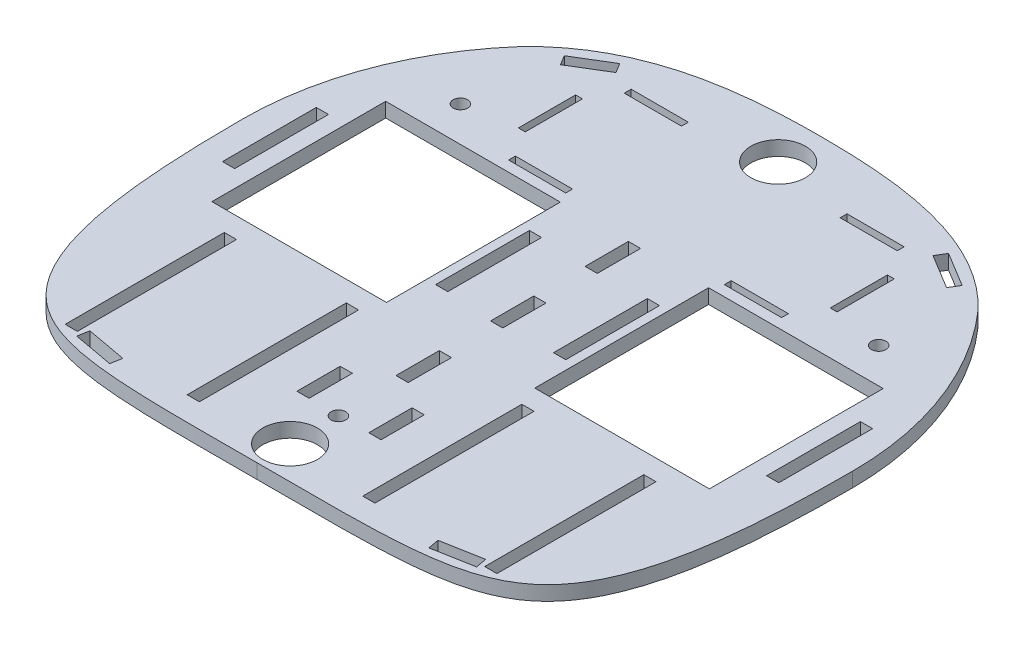
from build123d import *

# Parameters (mm, degrees)
BASE_DEPTH            = 6.35
SKETCH6_W             = 76.3515
SKETCH6_H             = 76
SKETCH6_W_2           = 5.334
SKETCH6_H_2           = 41.021
WHEELSHAFTCUT_DEPTH   = 189.692256213
SKETCH8_W             = 5.334
SKETCH8_H             = 69.573
SKETCH8_H_2           = 18.923
MOTORCUT_DEPTH        = 189.692256213
SKETCH10_W            = 25
SKETCH10_H            = 3
SKETCH10_W_2          = 3
SKETCH10_H_2          = 25
VELCROCUT_DEPTH       = 189.692256213
SKETCH11_R            = 3.175
SCREWCUT_DEPTH        = 189.692256213
SKETCH13_W            = 5.334
SKETCH13_H            = 18.923
SUPPORTSTRUTCUT_DEPTH = 189.692256213
EMPTYSPACETRIM_DEPTH  = 189.692256213
TAPESENSORCUT_DEPTH   = 185.275595127
SKETCH17_R            = 11.938
CASTERCUT_DEPTH       = 185.275595127


with BuildPart() as part:
    # Sketch1 → Base (new body)
    with BuildSketch(Plane(origin=(0, 0, 0), x_dir=(1, 0, 0), z_dir=(0, 1, 0))):
        with BuildLine():
            ThreePointArc((133.35, 0), (0, 133.35), (-133.35, 0))
            add(Edge.make_bspline(
                [(-133.35, 0), (-133.35, -51.197979728), (-123.803376308, -129.805052089), (-58.427993604, -127), (0, -127)],
                knots=[0, 0, 0, 0, 0.502616309, 1, 1, 1, 1], degree=3))
            add(Edge.make_bspline(
                [(133.35, 0), (133.35, -51.197979728), (123.803376308, -129.805052089), (58.427993604, -127), (0, -127)],
                knots=[0, 0, 0, 0, 0.502616309, 1, 1, 1, 1], degree=3))
        make_face()
    extrude(amount=BASE_DEPTH)

    # Sketch6 → WheelShaftCut (cut, through all)
    with BuildSketch(Plane(origin=(0, 6.35, 0), x_dir=(1, 0, 0), z_dir=(0, 1, 0))):
        with Locations((-70.592348141, 0)):
            Rectangle(SKETCH6_W, SKETCH6_H)
        with Locations((-118.959848141, 0)):
            Rectangle(SKETCH6_W_2, SKETCH6_H_2)
        with Locations((-25.780848141, 0)):
            Rectangle(SKETCH6_W_2, SKETCH6_H_2)
        with Locations((25.780848141, 0)):
            Rectangle(SKETCH6_W_2, SKETCH6_H_2)
        with Locations((118.959848141, 0)):
            Rectangle(SKETCH6_W_2, SKETCH6_H_2)
        with Locations((70.592348141, 0)):
            Rectangle(SKETCH6_W, SKETCH6_H)
    extrude(amount=-WHEELSHAFTCUT_DEPTH, mode=Mode.SUBTRACT)

    # Sketch8 → MotorCut (cut, through all)
    with BuildSketch(Plane(origin=(0, 6.35, 0), x_dir=(1, 0, 0), z_dir=(0, 1, 0))):
        with Locations((-38.378348141, -81.74)):
            Rectangle(SKETCH8_W, SKETCH8_H)
        with Locations((-91.718348141, -81.74)):
            Rectangle(SKETCH8_W, SKETCH8_H)
        with Locations((15.718348141, -81.74)):
            Rectangle(SKETCH8_W, SKETCH8_H_2)
        with Locations((91.718348141, -81.74)):
            Rectangle(SKETCH8_W, SKETCH8_H)
        with Locations((38.378348141, -81.74)):
            Rectangle(SKETCH8_W, SKETCH8_H)
        with Locations((-15.718348141, -81.74)):
            Rectangle(SKETCH8_W, SKETCH8_H_2)
    extrude(amount=-MOTORCUT_DEPTH, mode=Mode.SUBTRACT)

    # Sketch10 → VelcroCut (cut, through all)
    with BuildSketch(Plane(origin=(0, 6.35, 0), x_dir=(1, 0, 0), z_dir=(0, 1, 0))):
        with Locations((-47.19, 44.12)):
            Rectangle(SKETCH10_W, SKETCH10_H)
        with Locations((-47.19, 94.745)):
            Rectangle(SKETCH10_W, SKETCH10_H)
        with Locations((-68.175, 69.4325)):
            Rectangle(SKETCH10_W_2, SKETCH10_H_2)
        with Locations((68.175, 69.4325)):
            Rectangle(SKETCH10_W_2, SKETCH10_H_2)
        with Locations((47.19, 94.745)):
            Rectangle(SKETCH10_W, SKETCH10_H)
        with Locations((47.19, 44.12)):
            Rectangle(SKETCH10_W, SKETCH10_H)
    extrude(amount=-VELCROCUT_DEPTH, mode=Mode.SUBTRACT)

    # Sketch11 → ScrewCut (cut, through all)
    with BuildSketch(Plane(origin=(0, 6.35, 0), x_dir=(1, 0, 0), z_dir=(0, 1, 0))):
        with Locations((0, -91.44)):
            Circle(SKETCH11_R)
        with Locations((-91.44, 53.34)):
            Circle(SKETCH11_R)
        with Locations((91.44, 53.34)):
            Circle(SKETCH11_R)
    extrude(amount=-SCREWCUT_DEPTH, mode=Mode.SUBTRACT)

    # Sketch13 → SupportStrutCut (cut, through all)
    with BuildSketch(Plane(origin=(0, 6.35, 0), x_dir=(1, 0, 0), z_dir=(0, 1, 0))):
        with Locations((0, 28.5385)):
            Rectangle(SKETCH13_W, SKETCH13_H)
        with Locations((0, -12.8)):
            Rectangle(SKETCH13_W, SKETCH13_H)
        with Locations((0, -54.1385)):
            Rectangle(SKETCH13_W, SKETCH13_H)
    extrude(amount=-SUPPORTSTRUTCUT_DEPTH, mode=Mode.SUBTRACT)

    # Sketch16 → EmptySpaceTrim (cut, through all)
    with BuildSketch(Plane(origin=(0, 6.35, 0), x_dir=(1, 0, 0), z_dir=(0, 1, 0))):
        with BuildLine():
            Line((-100.033122546, 133.35), (-100.033122546, 88.179345052))
            add(Edge.make_bspline(
                [(-100.033122546, 88.179345052), (-73.919529929, 115.91021885), (-34.972901221, 119.822808394), (0, 119.822808394)],
                knots=[0, 0, 0, 0, 1, 1, 1, 1], degree=3))
            add(Edge.make_bspline(
                [(100.033122546, 88.179345052), (73.919529929, 115.91021885), (34.972901221, 119.822808394), (0, 119.822808394)],
                knots=[0, 0, 0, 0, 1, 1, 1, 1], degree=3))
            Line((100.033122546, 88.179345052), (100.033122546, 133.35))
            Line((100.033122546, 133.35), (-100.033122546, 133.35))
        make_face()
    extrude(amount=-EMPTYSPACETRIM_DEPTH, mode=Mode.SUBTRACT)

    # Sketch15 → TapeSensorCut (cut, through all)
    with BuildSketch(Plane(origin=(0, 6.35, 0), x_dir=(1, 0, 0), z_dir=(0, 1, 0))):
        Polygon((-87.418704088, -118.459321106), (-69.765704088, -121.679864084), (-68.876770565, -116.807287128), (-86.529770565, -113.58674415), align=None)
        Polygon((-84.406611309, 90.060423031), (-69.317948313, 99.223427887), (-71.888863344, 103.456937649), (-86.97752634, 94.293932793), align=None)
        Polygon((86.97752634, 94.293932793), (71.888863344, 103.456937649), (69.317948313, 99.223427887), (84.406611309, 90.060423031), align=None)
        Polygon((86.529770565, -113.58674415), (68.876770565, -116.807287128), (69.765704088, -121.679864084), (87.418704088, -118.459321106), align=None)
    extrude(amount=-TAPESENSORCUT_DEPTH, mode=Mode.SUBTRACT)

    # Sketch17 → CasterCut (cut, through all)
    with BuildSketch(Plane(origin=(0, 6.35, 0), x_dir=(1, 0, 0), z_dir=(0, 1, 0))):
        with Locations((0, 100.834589665)):
            Circle(SKETCH17_R)
        with Locations((0, -112.562458365)):
            Circle(SKETCH17_R)
    extrude(amount=-CASTERCUT_DEPTH, mode=Mode.SUBTRACT)


solid = part.part
